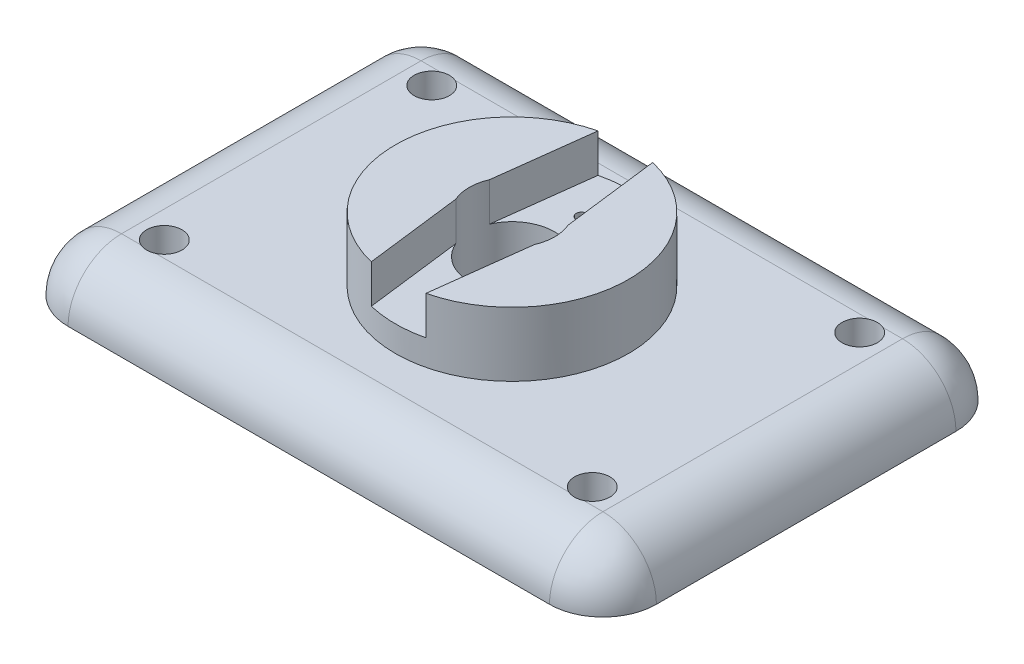
from build123d import *

# Parameters (mm, degrees)
SKETCH_1_W          = 55
SKETCH_1_H          = 38
EXTRUDE_1_DEPTH     = 5
SKETCH_2_R          = 10.9
EXTRUDE_2_DEPTH     = 6
SKETCH_3_R          = 4
CUT_EXTRUDE_1_DEPTH = 36.18877662
CUT_EXTRUDE_2_DEPTH = 3.6
SKETCH_5_R          = 0.5
CUT_EXTRUDE_3_DEPTH = 4
FILLET_1_R          = 5
FILLET_2_R          = 5
FILLET_3_R          = 5
FILLET_4_R          = 5
FILLET_5_R          = 5
SKETCH_6_R          = 1.65
CUT_EXTRUDE_4_DEPTH = 36.18877662


with BuildPart() as part:
    # 草图1 → 凸台-拉伸1 (new body)
    with BuildSketch(Plane(origin=(0, 0, 0), x_dir=(1, 0, 0), z_dir=(0, 1, 0))):
        Rectangle(SKETCH_1_W, SKETCH_1_H)
    extrude(amount=EXTRUDE_1_DEPTH)

    # 草图2 → 凸台-拉伸2 (add)
    with BuildSketch(Plane(origin=(0, 5, 0), x_dir=(1, 0, 0), z_dir=(0, 1, 0))):
        with Locations(Location((0, 0, 0), (0, 0, 270))):
            Circle(SKETCH_2_R)
    extrude(amount=EXTRUDE_2_DEPTH)

    # 草图3 → 切除-拉伸1 (cut, through all)
    with BuildSketch(Plane.XZ):
        with Locations(Location((0, 0, 0), (0, 0, 270))):
            Circle(SKETCH_3_R)
    extrude(amount=-CUT_EXTRUDE_1_DEPTH, mode=Mode.SUBTRACT)

    # 草图4 → 切除-拉伸2 (cut)
    with BuildSketch(Plane(origin=(0, 11, 0), x_dir=(1, 0, 0), z_dir=(0, 1, 0))):
        Polygon((3.674809939, -1.579801226), (2.341337155, -12.320336373), (-2.341337155, -12.320336373), (-3.674809939, -1.579801226), align=None)
        Polygon((-3.674809939, 1.579801226), (-2.341337155, 12.320336373), (2.341337155, 12.320336373), (3.674809939, 1.579801226), align=None)
    extrude(amount=-CUT_EXTRUDE_2_DEPTH, mode=Mode.SUBTRACT)

    # 草图5 → 切除-拉伸3 (cut)
    with BuildSketch(Plane(origin=(0, 7.4, 0), x_dir=(1, 0, 0), z_dir=(0, 1, 0))):
        with Locations(Location((0, -6.5, 0), (0, 0, 270))):
            Circle(SKETCH_5_R)
        with Locations(Location((0, 6.5, 0), (0, 0, 270))):
            Circle(SKETCH_5_R)
    extrude(amount=-CUT_EXTRUDE_3_DEPTH, mode=Mode.SUBTRACT)

    # 圆角1
    fillet_1_edges = [part.edges().sort_by_distance(p)[0] for p in [
        (27.5, 2.5, 19),
    ]]
    fillet(fillet_1_edges, radius=FILLET_1_R)

    # 圆角2
    fillet_2_edges = [part.edges().sort_by_distance(p)[0] for p in [
        (-27.5, 2.5, 19),
    ]]
    fillet(fillet_2_edges, radius=FILLET_2_R)

    # 圆角3
    fillet_3_edges = [part.edges().sort_by_distance(p)[0] for p in [
        (-27.5, 2.5, -19),
    ]]
    fillet(fillet_3_edges, radius=FILLET_3_R)

    # 圆角4
    fillet_4_edges = [part.edges().sort_by_distance(p)[0] for p in [
        (27.5, 2.5, -19),
    ]]
    fillet(fillet_4_edges, radius=FILLET_4_R)

    # 圆角5
    fillet_5_edges = [part.edges().sort_by_distance(p)[0] for p in [
        (27.5, 5, 0),
        (0, 5, 19),
        (-27.5, 5, 0),
        (0, 5, -19),
        (26.035533906, 5, 17.535533906),
        (-26.035533906, 5, 17.535533906),
        (-26.035533906, 5, -17.535533906),
        (26.035533906, 5, -17.535533906),
    ]]
    fillet(fillet_5_edges, radius=FILLET_5_R - 0.0001)  # a hair under: the kernel refuses the full size

    # 草图6 → 切除-拉伸4 (cut, through all)
    with BuildSketch(Plane.XZ):
        with Locations(Location((-20, 12.5, 0), (0, 0, 270))):
            Circle(SKETCH_6_R)
        with Locations(Location((20, 12.5, 0), (0, 0, 270))):
            Circle(SKETCH_6_R)
        with Locations(Location((20, -12.5, 0), (0, 0, 270))):
            Circle(SKETCH_6_R)
        with Locations(Location((-20, -12.5, 0), (0, 0, 270))):
            Circle(SKETCH_6_R)
    extrude(amount=-CUT_EXTRUDE_4_DEPTH, mode=Mode.SUBTRACT)


solid = part.part
